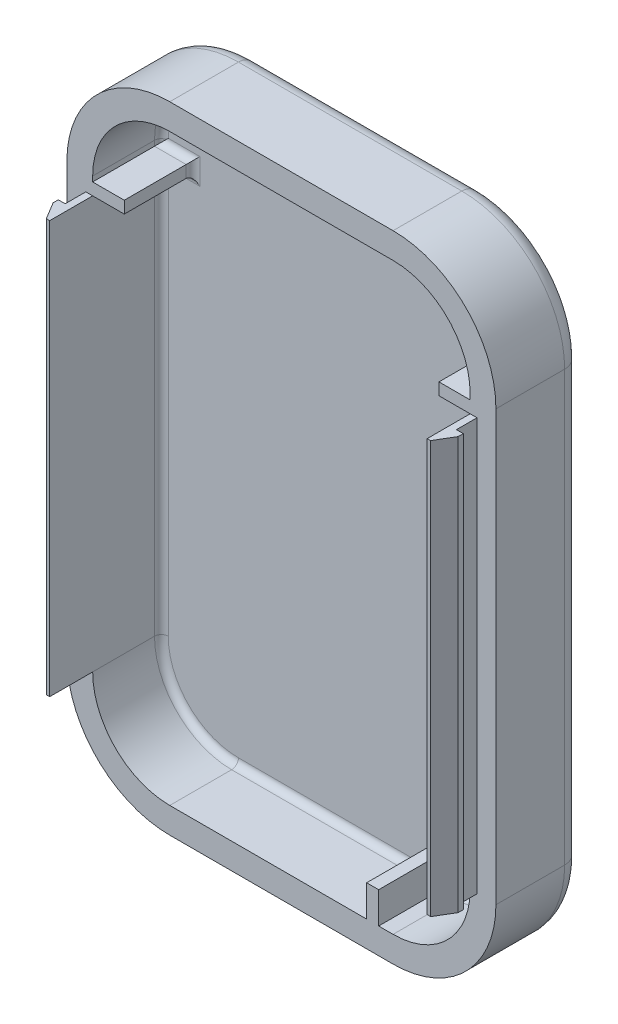
from build123d import *

# Parameters (mm, degrees)
BOSS_EXTRUDE1_DEPTH = 4
BOSS_EXTRUDE2_DEPTH = 1
SKETCH3_W           = 0.8
SKETCH3_H           = 24.00004826
BOSS_EXTRUDE3_DEPTH = 2.5
CUT_EXTRUDE1_REACH  = 48.525
SKETCH4_W           = 0.4
SKETCH4_H           = 1.2
FILLET1_R           = 1
FILLET2_R           = 0.4


with BuildPart() as part:
    # Sketch1 → Boss-Extrude1 (new body)
    with BuildSketch(Plane(origin=(0, 0, 25.980449513), x_dir=(-1, 0, 0), z_dir=(0, 0, -1))):
        with BuildLine():
            Line((-0.842601542, 36.360791374), (-13.842629482, 36.360791374))
            ThreePointArc((-13.842629482, 36.360791374), (-18.076295283, 34.607149581), (-19.829937076, 30.37348378))
            Line((-19.829937076, 30.37348378), (-19.829937076, 5.373432979))
            ThreePointArc((-19.829937076, 5.373432979), (-18.076295283, 1.139767178), (-13.842629482, -0.613874615))
            Line((-13.842629482, -0.613874615), (-0.842601542, -0.613874615))
            ThreePointArc((-0.842601542, -0.613874615), (3.391064259, 1.139767178), (5.144706053, 5.373432979))
            Line((5.144706053, 5.373432979), (5.144706053, 30.37348378))
            ThreePointArc((5.144706053, 30.37348378), (3.391064259, 34.607149581), (-0.842601542, 36.360791374))
        make_face()
        with BuildLine():
            Line((-18.329937076, 29.373481239), (-16.513394023, 29.373481239))
            Line((-16.513394023, 29.373481239), (-16.513394023, 30.07348378))
            Line((-16.513394023, 30.07348378), (-18.329937076, 30.07348378))
            Line((-18.329937076, 30.07348378), (-18.329937076, 30.37348378))
            ThreePointArc((-18.329937076, 30.37348378), (-17.015635111, 33.546489409), (-13.842629482, 34.860791374))
            Line((-13.842629482, 34.860791374), (-0.842601542, 34.860791374))
            ThreePointArc((-0.842601542, 34.860791374), (2.330404088, 33.546489409), (3.644706053, 30.37348378))
            Line((3.644706053, 30.37348378), (3.644706053, 30.07348378))
            Line((3.644706053, 30.07348378), (1.804401252, 30.07348378))
            Line((1.804401252, 30.07348378), (1.804401252, 29.373481239))
            Line((1.804401252, 29.373481239), (3.644706053, 29.373481239))
            Line((3.644706053, 29.373481239), (3.644706053, 5.373432979))
            ThreePointArc((3.644706053, 5.373432979), (2.330404088, 2.20042735), (-0.842601542, 0.886125385))
            Line((-0.842601542, 0.886125385), (-12.302827602, 0.886125385))
            Line((-12.302827602, 0.886125385), (-12.302827602, 2.717512228))
            Line((-12.302827602, 2.717512228), (-13.002830142, 2.717512228))
            Line((-13.002830142, 2.717512228), (-13.002830142, 0.886125385))
            Line((-13.002830142, 0.886125385), (-13.842629482, 0.886125385))
            ThreePointArc((-13.842629482, 0.886125385), (-17.015635111, 2.20042735), (-18.329937076, 5.373432979))
            Line((-18.329937076, 5.373432979), (-18.329937076, 29.373481239))
        make_face(mode=Mode.SUBTRACT)
    extrude(amount=BOSS_EXTRUDE1_DEPTH)

    # Sketch2 → Boss-Extrude2 (add)
    with BuildSketch(Plane(origin=(0, 0, 21.980449513), x_dir=(-1, 0, 0), z_dir=(0, 0, -1))):
        with BuildLine():
            Line((-19.829937076, 30.37348378), (-19.829937076, 5.373432979))
            ThreePointArc((-19.829937076, 5.373432979), (-18.076295283, 1.139767178), (-13.842629482, -0.613874615))
            Line((-13.842629482, -0.613874615), (-0.842601542, -0.613874615))
            ThreePointArc((-0.842601542, -0.613874615), (3.391064259, 1.139767178), (5.144706053, 5.373432979))
            Line((5.144706053, 5.373432979), (5.144706053, 30.37348378))
            ThreePointArc((5.144706053, 30.37348378), (3.391064259, 34.607149581), (-0.842601542, 36.360791374))
            Line((-0.842601542, 36.360791374), (-13.842629482, 36.360791374))
            ThreePointArc((-13.842629482, 36.360791374), (-18.076295283, 34.607149581), (-19.829937076, 30.37348378))
        make_face()
    extrude(amount=BOSS_EXTRUDE2_DEPTH)

    # Sketch3 → Boss-Extrude3 (add)
    with BuildSketch(Plane.XY.offset(25.980449513)):
        with Locations((-4.044706053, 17.373457109)):
            Rectangle(SKETCH3_W, SKETCH3_H)
        with Locations((18.729937076, 17.373457109)):
            Rectangle(SKETCH3_W, SKETCH3_H)
    extrude(amount=BOSS_EXTRUDE3_DEPTH)

    # Sketch4 → Cut-Extrude1 (cut, up to next)
    with BuildSketch(Plane.XZ.offset(-5.373432979), mode=Mode.PRIVATE) as cut_extrude1_sk1:
        with Locations((-4.244706053, 26.580449513)):
            Rectangle(SKETCH4_W, SKETCH4_H)
    cut_extrude1_tool1 = extrude(cut_extrude1_sk1.sketch, amount=-CUT_EXTRUDE1_REACH, mode=Mode.PRIVATE) & part.part
    # Sketch4 → Cut-Extrude1 (cut, up to next)
    with BuildSketch(Plane.XZ.offset(-5.373432979), mode=Mode.PRIVATE) as cut_extrude1_sk2:
        Polygon((-4.444706053, 28.480449513), (-4.444706053, 27.480449513), (-3.844706053, 28.480449513), align=None)
    cut_extrude1_tool2 = extrude(cut_extrude1_sk2.sketch, amount=-CUT_EXTRUDE1_REACH, mode=Mode.PRIVATE) & part.part
    # Sketch4 → Cut-Extrude1 (cut, up to next)
    with BuildSketch(Plane.XZ.offset(-5.373432979), mode=Mode.PRIVATE) as cut_extrude1_sk3:
        with Locations((18.929937076, 26.580449513)):
            Rectangle(SKETCH4_W, SKETCH4_H)
    cut_extrude1_tool3 = extrude(cut_extrude1_sk3.sketch, amount=-CUT_EXTRUDE1_REACH, mode=Mode.PRIVATE) & part.part
    # Sketch4 → Cut-Extrude1 (cut, up to next)
    with BuildSketch(Plane.XZ.offset(-5.373432979), mode=Mode.PRIVATE) as cut_extrude1_sk4:
        Polygon((18.529937076, 28.480449513), (19.129937076, 28.480449513), (19.129937076, 27.480449513), align=None)
    cut_extrude1_tool4 = extrude(cut_extrude1_sk4.sketch, amount=-CUT_EXTRUDE1_REACH, mode=Mode.PRIVATE) & part.part
    add(cut_extrude1_tool1.solids().sort_by_distance((-4.244706, 5.373433, 26.58045))[0], mode=Mode.SUBTRACT)
    add(cut_extrude1_tool2.solids().sort_by_distance((-4.244706, 5.373433, 28.147116))[0], mode=Mode.SUBTRACT)
    add(cut_extrude1_tool3.solids().sort_by_distance((18.929937, 5.373433, 26.58045))[0], mode=Mode.SUBTRACT)
    add(cut_extrude1_tool4.solids().sort_by_distance((18.929937, 5.373433, 28.147116))[0], mode=Mode.SUBTRACT)

    # Fillet1
    fillet1_edges = [part.edges().sort_by_distance(p)[0] for p in [
        (18.076295283, 34.607149581, 20.980449513),
        (19.829937076, 17.873458379, 20.980449513),
        (18.076295283, 1.139767178, 20.980449513),
        (7.342615512, -0.613874615, 20.980449513),
        (-3.391064259, 1.139767178, 20.980449513),
        (-5.144706053, 17.873458379, 20.980449513),
        (-3.391064259, 34.607149581, 20.980449513),
        (7.342615512, 36.360791374, 20.980449513),
    ]]
    fillet(fillet1_edges, radius=FILLET1_R)

    # Fillet2
    # the kernel refuses this fillet: 0.4 mm, written as the material it adds along each edge
    with BuildSketch(Plane(origin=(13.842629482, 34.860791374, 21.980449513), x_dir=(0, 0, 1), z_dir=(-1, 0, 0))) as fillet2_piece_1:
        with BuildLine():
            CenterArc((FILLET2_R, -FILLET2_R), FILLET2_R, 90, 90)
            Line((0, -FILLET2_R), (0, 0))
            Line((0, 0), (FILLET2_R, 0))
        make_face()
    extrude(amount=13.00002794)
    with BuildSketch(Plane(origin=(13.842629482, 30.37348378, 21.980449513), x_dir=(1, 0, 0), z_dir=(0, -1, 0))) as fillet2_piece_2:
        with BuildLine():
            CenterArc((4.487307595 - FILLET2_R, FILLET2_R), FILLET2_R, 270, 90)
            Line((4.487307595 - FILLET2_R, 0), (4.487307595, 0))
            Line((4.487307595, 0), (4.487307595, FILLET2_R))
        make_face()
    revolve(axis=Axis((13.842629482, 30.37348378, 21.980449513), (0, 0, 1)), revolution_arc=90)
    with BuildSketch(Plane(origin=(16.513394023, 30.07348378, 21.980449513), x_dir=(0, 0, 1), z_dir=(1, 0, 0)), Plane(origin=(19.329937076, 29.373481239, 21.980449513), x_dir=(0, 0, 1), z_dir=(-1, 0, 0))) as fillet2_piece_3:
        with BuildLine():
            CenterArc((FILLET2_R, -FILLET2_R), FILLET2_R, 90, 90)
            Line((0, -FILLET2_R), (0, 0))
            Line((0, 0), (FILLET2_R, 0))
        make_face()
    extrude(amount=2.816543053)
    with BuildSketch(Plane(origin=(16.513394023, 29.373481239, 21.980449513), x_dir=(0, 0, 1), z_dir=(0, 1, 0)), Plane(origin=(12.302827602, 2.717512228, 21.980449513), x_dir=(0, 0, 1), z_dir=(1, 0, 0)), Plane(origin=(-1.804401252, 30.07348378, 21.980449513), x_dir=(0, 0, 1), z_dir=(0, -1, 0))) as fillet2_piece_4:
        with BuildLine():
            CenterArc((FILLET2_R, -FILLET2_R), FILLET2_R, 90, 90)
            Line((0, -FILLET2_R), (0, 0))
            Line((0, 0), (FILLET2_R, 0))
        make_face()
    extrude(amount=0.70000254)
    with BuildSketch(Plane(origin=(18.329937076, 5.373432979, 21.980449513), x_dir=(-1, 0, 0), z_dir=(0, 1, 0)), Plane(origin=(-3.644706053, 30.373481239, 21.980449513), x_dir=(1, 0, 0), z_dir=(0, -1, 0))) as fillet2_piece_5:
        with BuildLine():
            CenterArc((FILLET2_R, FILLET2_R), FILLET2_R, 180, 90)
            Line((0, FILLET2_R), (0, 0))
            Line((0, 0), (FILLET2_R, 0))
        make_face()
    extrude(amount=25.00004826)
    with BuildSketch(Plane(origin=(13.842629482, 5.373432979, 21.980449513), x_dir=(0, -1, 0), z_dir=(-1, 0, 0))) as fillet2_piece_6:
        with BuildLine():
            CenterArc((4.487307595 - FILLET2_R, FILLET2_R), FILLET2_R, 270, 90)
            Line((4.487307595 - FILLET2_R, 0), (4.487307595, 0))
            Line((4.487307595, 0), (4.487307595, FILLET2_R))
        make_face()
    revolve(axis=Axis((13.842629482, 5.373432979, 21.980449513), (0, 0, 1)), revolution_arc=90)
    with BuildSketch(Plane(origin=(12.002830142, 0.886125385, 21.980449513), x_dir=(0, 0, 1), z_dir=(1, 0, 0))) as fillet2_piece_7:
        with BuildLine():
            CenterArc((FILLET2_R, -FILLET2_R), FILLET2_R, 90, 90)
            Line((0, -FILLET2_R), (0, 0))
            Line((0, 0), (FILLET2_R, 0))
        make_face()
    extrude(amount=1.83979934)
    with BuildSketch(Plane(origin=(13.002830142, 2.717512228, 21.980449513), x_dir=(0, 0, 1), z_dir=(0, -1, 0)), Plane(origin=(12.302827602, -0.113874615, 21.980449513), x_dir=(0, 0, 1), z_dir=(0, 1, 0))) as fillet2_piece_8:
        with BuildLine():
            CenterArc((FILLET2_R, -FILLET2_R), FILLET2_R, 90, 90)
            Line((0, -FILLET2_R), (0, 0))
            Line((0, 0), (FILLET2_R, 0))
        make_face()
    extrude(amount=2.831386843)
    with BuildSketch(Plane(origin=(0.842601542, 0.886125385, 21.980449513), x_dir=(0, 0, 1), z_dir=(1, 0, 0))) as fillet2_piece_9:
        with BuildLine():
            CenterArc((FILLET2_R, -FILLET2_R), FILLET2_R, 90, 90)
            Line((0, -FILLET2_R), (0, 0))
            Line((0, 0), (FILLET2_R, 0))
        make_face()
    extrude(amount=12.46022606)
    with BuildSketch(Plane(origin=(0.842601542, 5.373432979, 21.980449513), x_dir=(-1, 0, 0), z_dir=(0, 1, 0))) as fillet2_piece_10:
        with BuildLine():
            CenterArc((4.487307595 - FILLET2_R, FILLET2_R), FILLET2_R, 270, 90)
            Line((4.487307595 - FILLET2_R, 0), (4.487307595, 0))
            Line((4.487307595, 0), (4.487307595, FILLET2_R))
        make_face()
    revolve(axis=Axis((0.842601542, 5.373432979, 21.980449513), (0, 0, 1)), revolution_arc=90)
    with BuildSketch(Plane(origin=(-1.804401252, 29.373481239, 21.980449513), x_dir=(0, 0, 1), z_dir=(-1, 0, 0)), Plane(origin=(-4.644706053, 30.07348378, 21.980449513), x_dir=(0, 0, 1), z_dir=(1, 0, 0))) as fillet2_piece_11:
        with BuildLine():
            CenterArc((FILLET2_R, -FILLET2_R), FILLET2_R, 90, 90)
            Line((0, -FILLET2_R), (0, 0))
            Line((0, 0), (FILLET2_R, 0))
        make_face()
    extrude(amount=2.840304801)
    with BuildSketch(Plane(origin=(0.842601542, 30.37348378, 21.980449513), x_dir=(0, 1, 0), z_dir=(1, 0, 0))) as fillet2_piece_12:
        with BuildLine():
            CenterArc((4.487307595 - FILLET2_R, FILLET2_R), FILLET2_R, 270, 90)
            Line((4.487307595 - FILLET2_R, 0), (4.487307595, 0))
            Line((4.487307595, 0), (4.487307595, FILLET2_R))
        make_face()
    revolve(axis=Axis((0.842601542, 30.37348378, 21.980449513), (0, 0, 1)), revolution_arc=90)
    with BuildSketch(Plane(origin=(-3.644706053, 30.37348378, 21.980449513), x_dir=(0, 0, 1), z_dir=(0, -1, 0)), Plane(origin=(18.329937076, 29.07348378, 21.980449513), x_dir=(0, 0, 1), z_dir=(0, 1, 0))) as fillet2_piece_13:
        with BuildLine():
            CenterArc((FILLET2_R, -FILLET2_R), FILLET2_R, 90, 90)
            Line((0, -FILLET2_R), (0, 0))
            Line((0, 0), (FILLET2_R, 0))
        make_face()
    extrude(amount=1.3)
    with BuildSketch(Plane(origin=(16.513394023, 29.373481239, 21.980449513), x_dir=(0, 0, 1), z_dir=(0, 1, 0))) as fillet2_piece_14a_section:
        with BuildLine():
            CenterArc((FILLET2_R, -FILLET2_R), FILLET2_R, 90, 90)
            Line((0, -FILLET2_R), (0, 0))
            Line((0, 0), (FILLET2_R, 0))
        make_face()
    fillet2_piece_14a = extrude(amount=1.70000254, mode=Mode.PRIVATE)
    fillet2_piece_14a = split(fillet2_piece_14a, bisect_by=Plane(origin=(16.422835978, 30.07348378, 22.071007558), z_dir=(0, 1, 0)), keep=Keep.TOP, mode=Mode.PRIVATE)
    with BuildSketch(Plane(origin=(15.513394023, 30.07348378, 21.980449513), x_dir=(0, 0, 1), z_dir=(1, 0, 0))) as fillet2_piece_14b_section:
        with BuildLine():
            CenterArc((FILLET2_R, -FILLET2_R), FILLET2_R, 90, 90)
            Line((0, -FILLET2_R), (0, 0))
            Line((0, 0), (FILLET2_R, 0))
        make_face()
    fillet2_piece_14b = extrude(amount=2.816543053, mode=Mode.PRIVATE)
    fillet2_piece_14b = split(fillet2_piece_14b, bisect_by=Plane(origin=(16.513394023, 30.164041825, 22.071007558), z_dir=(-1, 0, 0)), keep=Keep.TOP, mode=Mode.PRIVATE)
    fillet2_piece_14 = fillet2_piece_14a & fillet2_piece_14b
    add(fillet2_piece_14)
    with BuildSketch(Plane(origin=(18.329937076, 29.373481239, 21.980449513), x_dir=(0, 0, 1), z_dir=(-1, 0, 0))) as fillet2_piece_15a_section:
        with BuildLine():
            CenterArc((FILLET2_R, -FILLET2_R), FILLET2_R, 90, 90)
            Line((0, -FILLET2_R), (0, 0))
            Line((0, 0), (FILLET2_R, 0))
        make_face()
    fillet2_piece_15a = extrude(amount=2.816543053, mode=Mode.PRIVATE)
    fillet2_piece_15a = split(fillet2_piece_15a, bisect_by=Plane(origin=(16.513394023, 29.282923194, 22.071007558), z_dir=(-1, 0, 0)), keep=Keep.TOP, mode=Mode.PRIVATE)
    with BuildSketch(Plane(origin=(16.513394023, 28.373481239, 21.980449513), x_dir=(0, 0, 1), z_dir=(0, 1, 0))) as fillet2_piece_15b_section:
        with BuildLine():
            CenterArc((FILLET2_R, -FILLET2_R), FILLET2_R, 90, 90)
            Line((0, -FILLET2_R), (0, 0))
            Line((0, 0), (FILLET2_R, 0))
        make_face()
    fillet2_piece_15b = extrude(amount=1.70000254, mode=Mode.PRIVATE)
    fillet2_piece_15b = split(fillet2_piece_15b, bisect_by=Plane(origin=(16.422835978, 29.373481239, 22.071007558), z_dir=(0, -1, 0)), keep=Keep.TOP, mode=Mode.PRIVATE)
    fillet2_piece_15 = fillet2_piece_15a & fillet2_piece_15b
    add(fillet2_piece_15)
    with BuildSketch(Plane(origin=(12.302827602, 2.717512228, 21.980449513), x_dir=(0, 0, 1), z_dir=(1, 0, 0))) as fillet2_piece_16a_section:
        with BuildLine():
            CenterArc((FILLET2_R, -FILLET2_R), FILLET2_R, 90, 90)
            Line((0, -FILLET2_R), (0, 0))
            Line((0, 0), (FILLET2_R, 0))
        make_face()
    fillet2_piece_16a = extrude(amount=1.70000254, mode=Mode.PRIVATE)
    fillet2_piece_16a = split(fillet2_piece_16a, bisect_by=Plane(origin=(13.002830142, 2.808070273, 22.071007558), z_dir=(1, 0, 0)), keep=Keep.TOP, mode=Mode.PRIVATE)
    with BuildSketch(Plane(origin=(13.002830142, 3.717512228, 21.980449513), x_dir=(0, 0, 1), z_dir=(0, -1, 0))) as fillet2_piece_16b_section:
        with BuildLine():
            CenterArc((FILLET2_R, -FILLET2_R), FILLET2_R, 90, 90)
            Line((0, -FILLET2_R), (0, 0))
            Line((0, 0), (FILLET2_R, 0))
        make_face()
    fillet2_piece_16b = extrude(amount=2.831386843, mode=Mode.PRIVATE)
    fillet2_piece_16b = split(fillet2_piece_16b, bisect_by=Plane(origin=(13.093388188, 2.717512228, 22.071007558), z_dir=(0, 1, 0)), keep=Keep.TOP, mode=Mode.PRIVATE)
    fillet2_piece_16 = fillet2_piece_16a & fillet2_piece_16b
    add(fillet2_piece_16)
    with BuildSketch(Plane(origin=(12.302827602, 0.886125385, 21.980449513), x_dir=(0, 0, 1), z_dir=(0, 1, 0))) as fillet2_piece_17a_section:
        with BuildLine():
            CenterArc((FILLET2_R, -FILLET2_R), FILLET2_R, 90, 90)
            Line((0, -FILLET2_R), (0, 0))
            Line((0, 0), (FILLET2_R, 0))
        make_face()
    fillet2_piece_17a = extrude(amount=2.831386843, mode=Mode.PRIVATE)
    fillet2_piece_17a = split(fillet2_piece_17a, bisect_by=Plane(origin=(12.212269557, 2.717512228, 22.071007558), z_dir=(0, 1, 0)), keep=Keep.TOP, mode=Mode.PRIVATE)
    with BuildSketch(Plane(origin=(11.302827602, 2.717512228, 21.980449513), x_dir=(0, 0, 1), z_dir=(1, 0, 0))) as fillet2_piece_17b_section:
        with BuildLine():
            CenterArc((FILLET2_R, -FILLET2_R), FILLET2_R, 90, 90)
            Line((0, -FILLET2_R), (0, 0))
            Line((0, 0), (FILLET2_R, 0))
        make_face()
    fillet2_piece_17b = extrude(amount=1.70000254, mode=Mode.PRIVATE)
    fillet2_piece_17b = split(fillet2_piece_17b, bisect_by=Plane(origin=(12.302827602, 2.808070273, 22.071007558), z_dir=(-1, 0, 0)), keep=Keep.TOP, mode=Mode.PRIVATE)
    fillet2_piece_17 = fillet2_piece_17a & fillet2_piece_17b
    add(fillet2_piece_17)
    with BuildSketch(Plane(origin=(-1.804401252, 30.07348378, 21.980449513), x_dir=(0, 0, 1), z_dir=(0, -1, 0))) as fillet2_piece_18a_section:
        with BuildLine():
            CenterArc((FILLET2_R, -FILLET2_R), FILLET2_R, 90, 90)
            Line((0, -FILLET2_R), (0, 0))
            Line((0, 0), (FILLET2_R, 0))
        make_face()
    fillet2_piece_18a = extrude(amount=1.70000254, mode=Mode.PRIVATE)
    fillet2_piece_18a = split(fillet2_piece_18a, bisect_by=Plane(origin=(-1.713843206, 29.373481239, 22.071007558), z_dir=(0, -1, 0)), keep=Keep.TOP, mode=Mode.PRIVATE)
    with BuildSketch(Plane(origin=(-0.804401252, 29.373481239, 21.980449513), x_dir=(0, 0, 1), z_dir=(-1, 0, 0))) as fillet2_piece_18b_section:
        with BuildLine():
            CenterArc((FILLET2_R, -FILLET2_R), FILLET2_R, 90, 90)
            Line((0, -FILLET2_R), (0, 0))
            Line((0, 0), (FILLET2_R, 0))
        make_face()
    fillet2_piece_18b = extrude(amount=2.840304801, mode=Mode.PRIVATE)
    fillet2_piece_18b = split(fillet2_piece_18b, bisect_by=Plane(origin=(-1.804401252, 29.282923194, 22.071007558), z_dir=(1, 0, 0)), keep=Keep.TOP, mode=Mode.PRIVATE)
    fillet2_piece_18 = fillet2_piece_18a & fillet2_piece_18b
    add(fillet2_piece_18)
    with BuildSketch(Plane(origin=(-3.644706053, 30.07348378, 21.980449513), x_dir=(0, 0, 1), z_dir=(1, 0, 0))) as fillet2_piece_19a_section:
        with BuildLine():
            CenterArc((FILLET2_R, -FILLET2_R), FILLET2_R, 90, 90)
            Line((0, -FILLET2_R), (0, 0))
            Line((0, 0), (FILLET2_R, 0))
        make_face()
    fillet2_piece_19a = extrude(amount=2.840304801, mode=Mode.PRIVATE)
    fillet2_piece_19a = split(fillet2_piece_19a, bisect_by=Plane(origin=(-1.804401252, 30.164041825, 22.071007558), z_dir=(1, 0, 0)), keep=Keep.TOP, mode=Mode.PRIVATE)
    with BuildSketch(Plane(origin=(-1.804401252, 31.07348378, 21.980449513), x_dir=(0, 0, 1), z_dir=(0, -1, 0))) as fillet2_piece_19b_section:
        with BuildLine():
            CenterArc((FILLET2_R, -FILLET2_R), FILLET2_R, 90, 90)
            Line((0, -FILLET2_R), (0, 0))
            Line((0, 0), (FILLET2_R, 0))
        make_face()
    fillet2_piece_19b = extrude(amount=1.70000254, mode=Mode.PRIVATE)
    fillet2_piece_19b = split(fillet2_piece_19b, bisect_by=Plane(origin=(-1.713843206, 30.07348378, 22.071007558), z_dir=(0, 1, 0)), keep=Keep.TOP, mode=Mode.PRIVATE)
    fillet2_piece_19 = fillet2_piece_19a & fillet2_piece_19b
    add(fillet2_piece_19)


solid = part.part
